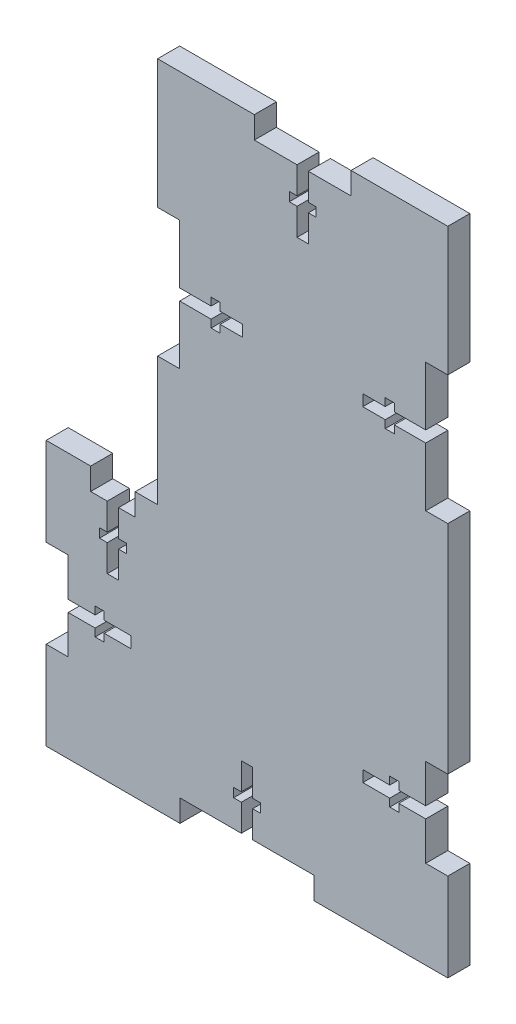
from build123d import *

# Parameters (mm, degrees)
SKETCH1_W           = 92.456
SKETCH1_H           = 60.96
BOSS_EXTRUDE1_DEPTH = 5.08
SKETCH2_W           = 10.244666666
SKETCH2_H           = 5.08
CUT_EXTRUDE1_DEPTH  = 56.604539239
SKETCH3_W           = 5.08
SKETCH3_H           = 20.32
CUT_EXTRUDE2_DEPTH  = 56.604539239
SKETCH4_W           = 14.478
SKETCH4_H           = 2.6035
CUT_EXTRUDE3_DEPTH  = 56.604539239
SKETCH5_W           = 2.6035
SKETCH5_H           = 14.478
CUT_EXTRUDE4_DEPTH  = 56.604539239
SKETCH6_W           = 6.1722
SKETCH6_H           = 2.0828
SKETCH6_W_2         = 2.0828
SKETCH6_H_2         = 6.1722
CUT_EXTRUDE5_DEPTH  = 56.604539239
SKETCH7_W           = 66.802
SKETCH7_H           = 88.9
BOSS_EXTRUDE2_DEPTH = 5.08
SKETCH8_W           = 30.818666666
SKETCH8_H           = 5.08
CUT_EXTRUDE6_DEPTH  = 129.118768274
SKETCH10_W          = 2.6035
SKETCH10_H          = 14.478
CUT_EXTRUDE7_DEPTH  = 129.118768274
SKETCH11_W          = 6.1722
SKETCH11_H          = 2.0828
CUT_EXTRUDE8_DEPTH  = 129.118768274
SKETCH12_W          = 5.08
SKETCH12_H          = 29.633333334
CUT_EXTRUDE9_DEPTH  = 129.118768274
SKETCH13_W          = 14.478
SKETCH13_H          = 2.6035
SKETCH13_W_2        = 2.6035
SKETCH13_H_2        = 19.558
CUT_EXTRUDE10_DEPTH = 129.118768274
SKETCH14_W          = 2.0828
SKETCH14_H          = 6.1722
SKETCH14_W_2        = 6.1722
SKETCH14_H_2        = 2.0828
CUT_EXTRUDE11_DEPTH = 129.118768274
SKETCH15_W          = 22.267333334
SKETCH15_H          = 5.08
CUT_EXTRUDE12_DEPTH = 129.118768274


with BuildPart() as part:
    # Sketch1 → Boss-Extrude1 (new body)
    with BuildSketch(Plane.XY):
        Rectangle(SKETCH1_W, SKETCH1_H)
    extrude(amount=BOSS_EXTRUDE1_DEPTH)

    # Sketch2 → Cut-Extrude1 (cut, through all)
    with BuildSketch(Plane.XY.offset(5.08)):
        with Locations((-30.861, 27.94)):
            Rectangle(SKETCH2_W, SKETCH2_H)
    extrude(amount=-CUT_EXTRUDE1_DEPTH, mode=Mode.SUBTRACT)

    # Sketch3 → Cut-Extrude2 (cut, through all)
    with BuildSketch(Plane.XY.offset(5.08)):
        with Locations((-43.688, 0)):
            Rectangle(SKETCH3_W, SKETCH3_H)
        with Locations((43.688, 0)):
            Rectangle(SKETCH3_W, SKETCH3_H)
    extrude(amount=-CUT_EXTRUDE2_DEPTH, mode=Mode.SUBTRACT)

    # Sketch4 → Cut-Extrude3 (cut, through all)
    with BuildSketch(Plane.XY.offset(5.08)):
        with Locations((-33.909, 0)):
            Rectangle(SKETCH4_W, SKETCH4_H)
        with Locations((33.909, 0)):
            Rectangle(SKETCH4_W, SKETCH4_H)
    extrude(amount=-CUT_EXTRUDE3_DEPTH, mode=Mode.SUBTRACT)

    # Sketch5 → Cut-Extrude4 (cut, through all)
    with BuildSketch(Plane.XY.offset(5.08)):
        with Locations((-30.861, 18.161)):
            Rectangle(SKETCH5_W, SKETCH5_H)
    extrude(amount=-CUT_EXTRUDE4_DEPTH, mode=Mode.SUBTRACT)

    # Sketch6 → Cut-Extrude5 (cut, through all)
    with BuildSketch(Plane.XY.offset(5.08)):
        with Locations((-30.861, 18.161)):
            Rectangle(SKETCH6_W, SKETCH6_H)
        with Locations((-33.909, 0)):
            Rectangle(SKETCH6_W_2, SKETCH6_H_2)
        with Locations((33.909, 0)):
            Rectangle(SKETCH6_W_2, SKETCH6_H_2)
    extrude(amount=-CUT_EXTRUDE5_DEPTH, mode=Mode.SUBTRACT)

    # Sketch7 → Boss-Extrude2 (add)
    with BuildSketch(Plane.XY.offset(5.08)):
        with Locations((12.827, 74.93)):
            Rectangle(SKETCH7_W, SKETCH7_H)
    extrude(amount=-BOSS_EXTRUDE2_DEPTH)

    # Sketch8 → Cut-Extrude6 (cut, through all)
    with BuildSketch(Plane.XY.offset(5.08)):
        with Locations((0, -27.94)):
            Rectangle(SKETCH8_W, SKETCH8_H)
    extrude(amount=-CUT_EXTRUDE6_DEPTH, mode=Mode.SUBTRACT)

    # Sketch10 → Cut-Extrude7 (cut, through all)
    with BuildSketch(Plane.XY.offset(5.08)):
        with Locations((0, -18.161)):
            Rectangle(SKETCH10_W, SKETCH10_H)
    extrude(amount=-CUT_EXTRUDE7_DEPTH, mode=Mode.SUBTRACT)

    # Sketch11 → Cut-Extrude8 (cut, through all)
    with BuildSketch(Plane.XY.offset(5.08)):
        with Locations((0, -18.161)):
            Rectangle(SKETCH11_W, SKETCH11_H)
    extrude(amount=-CUT_EXTRUDE8_DEPTH, mode=Mode.SUBTRACT)

    # Sketch12 → Cut-Extrude9 (cut, through all)
    with BuildSketch(Plane.XY.offset(5.08)):
        with Locations((43.688, 74.93)):
            Rectangle(SKETCH12_W, SKETCH12_H)
        with Locations((-18.034, 74.93)):
            Rectangle(SKETCH12_W, SKETCH12_H)
    extrude(amount=-CUT_EXTRUDE9_DEPTH, mode=Mode.SUBTRACT)

    # Sketch13 → Cut-Extrude10 (cut, through all)
    with BuildSketch(Plane.XY.offset(5.08)):
        with Locations((-8.255, 74.93)):
            Rectangle(SKETCH13_W, SKETCH13_H)
        with Locations((33.909, 74.93)):
            Rectangle(SKETCH13_W, SKETCH13_H)
        with Locations((12.827, 109.601)):
            Rectangle(SKETCH13_W_2, SKETCH13_H_2)
    extrude(amount=-CUT_EXTRUDE10_DEPTH, mode=Mode.SUBTRACT)

    # Sketch14 → Cut-Extrude11 (cut, through all)
    with BuildSketch(Plane.XY.offset(5.08)):
        with Locations((32.8676, 74.93)):
            Rectangle(SKETCH14_W, SKETCH14_H)
        with Locations((-7.2136, 74.93)):
            Rectangle(SKETCH14_W, SKETCH14_H)
        with Locations((12.827, 107.061)):
            Rectangle(SKETCH14_W_2, SKETCH14_H_2)
    extrude(amount=-CUT_EXTRUDE11_DEPTH, mode=Mode.SUBTRACT)

    # Sketch15 → Cut-Extrude12 (cut, through all)
    with BuildSketch(Plane.XY.offset(5.08)):
        with Locations((12.827, 116.84)):
            Rectangle(SKETCH15_W, SKETCH15_H)
    extrude(amount=-CUT_EXTRUDE12_DEPTH, mode=Mode.SUBTRACT)


solid = part.part
